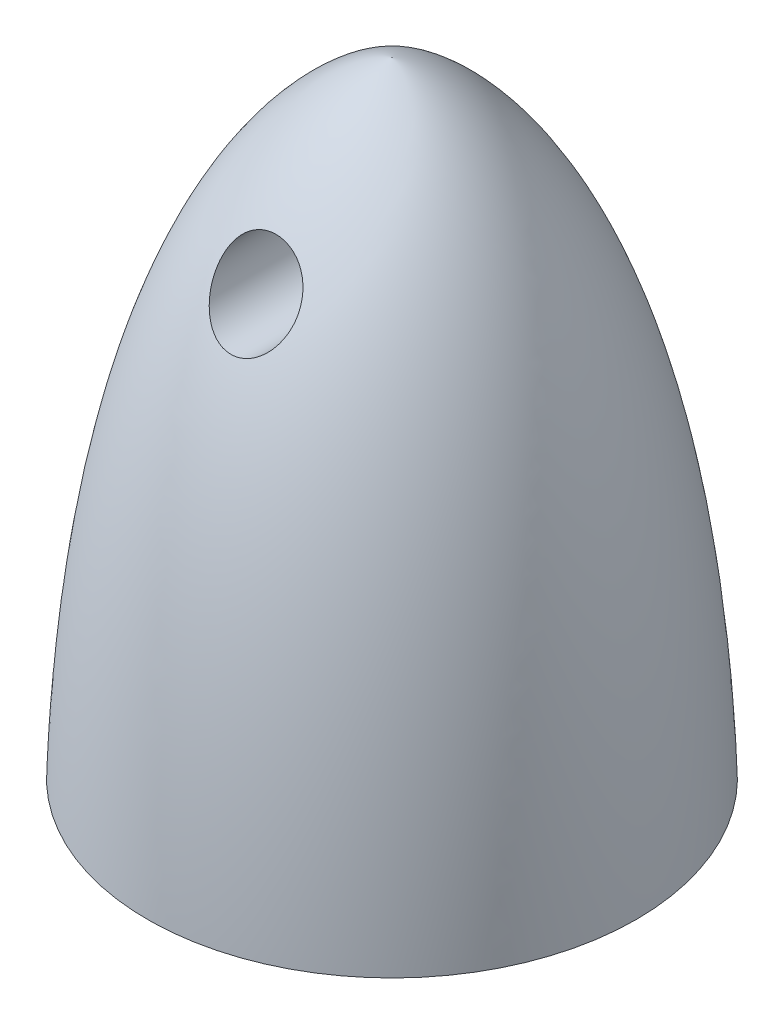
from build123d import *

# Parameters (mm, degrees)
CUT_EXTRUDE1_DEPTH = 7
SKETCH4_R          = 1.5
CUT_EXTRUDE2_DEPTH = 8.5
CHAMFER1_SIZE      = 0.5
FILLET1_R          = 0.5


with BuildPart() as part:
    # Sketch1 → Revolve1 (revolve)
    with BuildSketch(Plane.XY):
        with BuildLine():
            Line((3.5, 3.528396461), (3.5, 0))
            Line((3.5, 0), (9, 0))
            add(Edge.make_bspline(
                [(0, 23), (0.037336166, 22.983975753), (8.262108542, 21.480183495), (9, 0)],
                knots=[0, 0, 0, 0, 1, 1, 1, 1], degree=3))
            Line((0, 23), (0, 14))
            Line((0, 14), (3.5, 14))
            Line((3.5, 14), (3.5, 3.528396461))
        make_face()
    revolve(axis=Axis((0, 0, 0), (0, 1, 0)))

    # Sketch2 → Cut-Extrude1 (cut)
    with BuildSketch(Plane(origin=(0, 0, 0), x_dir=(1, 0, 0), z_dir=(0, 1, 0))):
        Polygon((5.629165125, 0), (2.814582562, 4.875), (-2.814582562, 4.875), (-5.629165125, 0), (-2.814582562, -4.875), (2.814582562, -4.875), align=None)
    extrude(amount=CUT_EXTRUDE1_DEPTH, mode=Mode.SUBTRACT)

    # Sketch4 → Cut-Extrude2 (cut, symmetric)
    with BuildSketch(Plane.XY):
        with Locations((0, 18)):
            Circle(SKETCH4_R)
    extrude(amount=CUT_EXTRUDE2_DEPTH, both=True, mode=Mode.SUBTRACT)

    # Chamfer1
    chamfer1_edges = [part.edges().sort_by_distance(p)[0] for p in [
        (-4.221873843, 0, 2.4375),
        (-4.221873843, 0, -2.4375),
        (0, 0, -4.875),
        (0, 0, 4.875),
        (4.221873843, 0, 2.4375),
        (4.221873843, 0, -2.4375),
    ]]
    chamfer(chamfer1_edges, length=CHAMFER1_SIZE)

    # Fillet1
    fillet1_edges = [part.edges().sort_by_distance(p)[0] for p in [
        (-3.5, 14, 0),
        (-3.5, 7, 0),
    ]]
    fillet(fillet1_edges, radius=FILLET1_R)


solid = part.part
